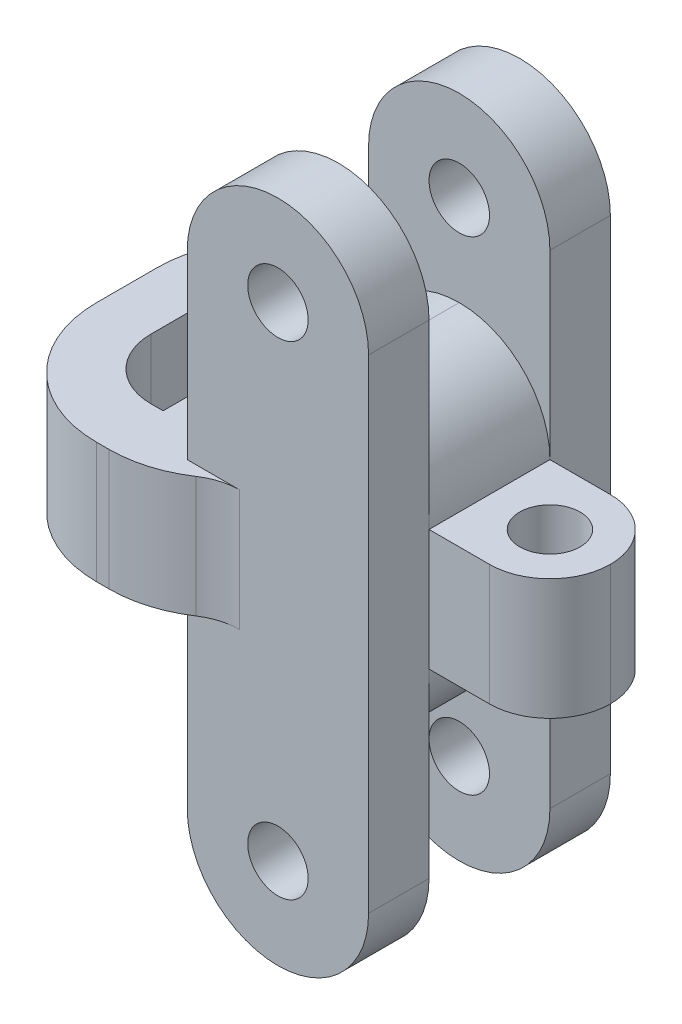
from build123d import *

# Parameters (mm, degrees)
SKETCH1_W           = 15
SKETCH1_H           = 25
BOSS_EXTRUDE1_DEPTH = 5
SKETCH2_R           = 2.5
BOSS_EXTRUDE2_DEPTH = 5
FILLET1_R           = 7.5
SKETCH3_W           = 10
SKETCH3_H           = 10
BOSS_EXTRUDE3_DEPTH = 10
FILLET2_R           = 5
SKETCH4_R           = 2.5
CUT_EXTRUDE1_DEPTH  = 10
SKETCH5_W           = 25
SKETCH5_H           = 10
BOSS_EXTRUDE4_DEPTH = 15
SKETCH6_W           = 6
SKETCH6_H           = 15
CUT_EXTRUDE2_DEPTH  = 15
FILLET3_R           = 5
FILLET4_R           = 10
FILLET5_R           = 5


# Some blends are built 0.0001 mm under size
with BuildPart() as part:
    # Sketch1 → Boss-Extrude1 (new, symmetric)
    with BuildSketch(Plane.XY):
        Rectangle(SKETCH1_W, SKETCH1_H)
    extrude(amount=BOSS_EXTRUDE1_DEPTH, both=True)

    # Sketch2 → Boss-Extrude2 (add)
    with BuildSketch(Plane.XY.offset(5)):
        with BuildLine():
            ThreePointArc((-7.5, -20), (0, -27.5), (7.5, -20))
            Line((7.5, -20), (7.5, 20))
            ThreePointArc((7.5, 20), (0, 27.5), (-7.5, 20))
            Line((-7.5, 20), (-7.5, -20))
        make_face()
        with Locations((0, -20)):
            Circle(SKETCH2_R, mode=Mode.SUBTRACT)
        with Locations((0, 20)):
            Circle(SKETCH2_R, mode=Mode.SUBTRACT)
    boss_extrude2 = extrude(amount=BOSS_EXTRUDE2_DEPTH)

    # Mirror1: Boss-Extrude2 across plane
    add(boss_extrude2.mirror(Plane.XY))

    # Fillet1
    fillet1_edges = [part.edges().sort_by_distance(p)[0] for p in [
        (7.5, -12.5, 0),
        (-7.5, -12.5, 0),
        (-7.5, 12.5, 0),
        (7.5, 12.5, 0),
    ]]
    fillet(fillet1_edges, radius=FILLET1_R - 0.0001)  # a hair under: the kernel refuses the full size

    # Sketch3 → Boss-Extrude3 (add)
    with BuildSketch(Plane(origin=(7.5, 0, 0), x_dir=(0, 0, -1), z_dir=(1, 0, 0))):
        Rectangle(SKETCH3_W, SKETCH3_H)
    extrude(amount=BOSS_EXTRUDE3_DEPTH)

    # Fillet2
    fillet2_edges = [part.edges().sort_by_distance(p)[0] for p in [
        (17.5, 0, 5),
        (17.5, 0, -5),
    ]]
    fillet(fillet2_edges, radius=FILLET2_R - 0.0001)  # a hair under: the kernel refuses the full size

    # Sketch4 → Cut-Extrude1 (cut)
    with BuildSketch(Plane(origin=(0, 5, 0), x_dir=(1, 0, 0), z_dir=(0, 1, 0))):
        with Locations(Location((12.5, 0, 0), (0, 0, 270))):
            Circle(SKETCH4_R)
    extrude(amount=-CUT_EXTRUDE1_DEPTH, mode=Mode.SUBTRACT)

    # Sketch5 → Boss-Extrude4 (add)
    with BuildSketch(Plane.ZY.offset(7.5)):
        Rectangle(SKETCH5_W, SKETCH5_H)
    extrude(amount=BOSS_EXTRUDE4_DEPTH)

    # Sketch6 → Cut-Extrude2 (cut)
    with BuildSketch(Plane.XZ.offset(5)):
        with Locations((-15, 0)):
            Rectangle(SKETCH6_W, SKETCH6_H)
    extrude(amount=-CUT_EXTRUDE2_DEPTH, mode=Mode.SUBTRACT)

    # Fillet3
    # the kernel refuses this fillet: 5 mm, written as the material it adds along each edge
    with BuildSketch(Plane(origin=(-7.5, 5, 10), x_dir=(1, 0, 0), z_dir=(0, -1, 0))) as fillet3_piece_1:
        with BuildLine():
            CenterArc((4.330127019, 5), FILLET3_R, 210, 60)
            Line((0, 2.5), (0, 0))
            Line((0, 0), (4.330127019, 0))
        make_face()
    extrude(amount=10)
    with BuildSketch(Plane(origin=(-7.5, 5, -10), x_dir=(1, 0, 0), z_dir=(0, -1, 0))) as fillet3_piece_2:
        with BuildLine():
            CenterArc((4.330127019, -5), FILLET3_R, 90, 60)
            Line((0, -2.5), (0, 0))
            Line((0, 0), (4.330127019, 0))
        make_face()
    extrude(amount=10)

    # Fillet4
    fillet4_edges = [part.edges().sort_by_distance(p)[0] for p in [
        (-7.5, 0, 12.5),
        (-7.5, 0, -12.5),
        (-22.5, 0, 12.5),
        (-22.5, 0, -12.5),
    ]]
    fillet(fillet4_edges, radius=FILLET4_R)

    # Fillet5
    fillet5_edges = [part.edges().sort_by_distance(p)[0] for p in [
        (-18, 0, -7.5),
        (-18, 0, 7.5),
    ]]
    fillet(fillet5_edges, radius=FILLET5_R)


solid = part.part
